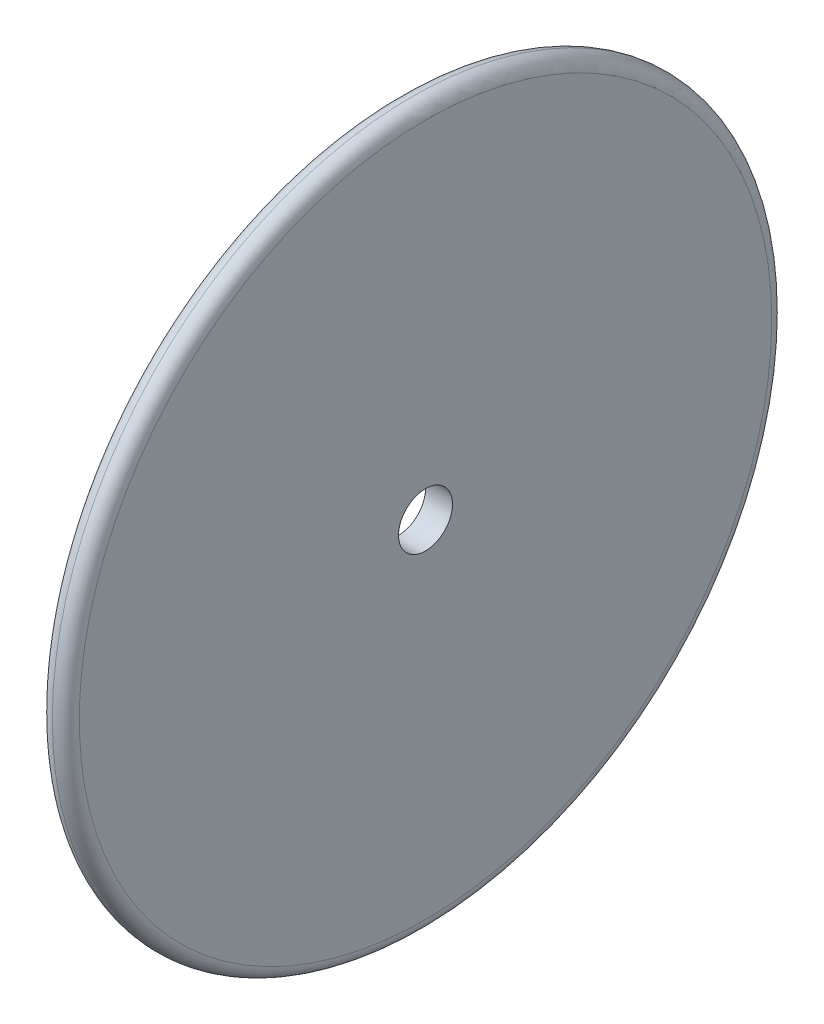
from build123d import *

# Parameters (mm, degrees)
SKETCH1_R           = 20
SKETCH1_R_2         = 1.5
BOSS_EXTRUDE2_DEPTH = 1.5
FILLET1_R           = 0.75


with BuildPart() as part:
    # Sketch1 → Boss-Extrude2 (new body)
    with BuildSketch(Plane.YZ):
        with Locations(Location((0, 0, 0), (0, 0, 270))):
            Circle(SKETCH1_R)
        with Locations(Location((0, 0, 0), (0, 0, 270))):
            Circle(SKETCH1_R_2, mode=Mode.SUBTRACT)
    extrude(amount=BOSS_EXTRUDE2_DEPTH)

    # Fillet1
    fillet1_edges = [part.edges().sort_by_distance(p)[0] for p in [
        (0, 0, 20),
        (1.5, 0, 20),
    ]]
    fillet(fillet1_edges, radius=FILLET1_R - 0.0001)  # a hair under: the kernel refuses the full size


solid = part.part
